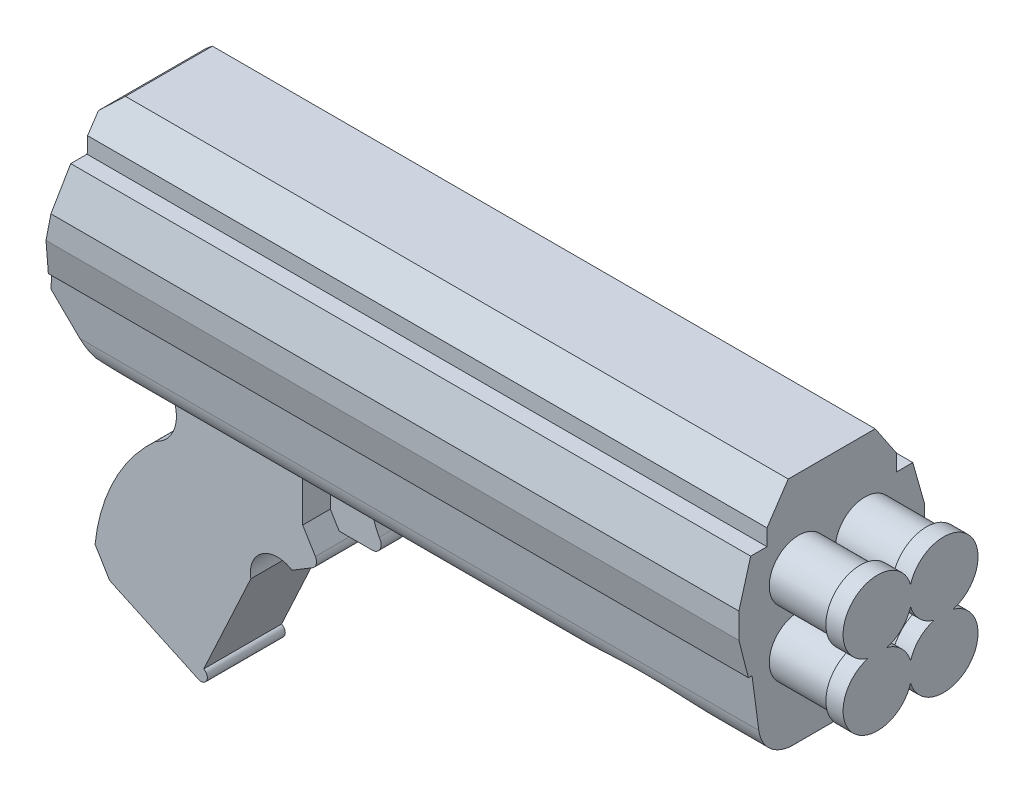
from build123d import *

# Parameters (mm, degrees)
BOSS_EXTRUDE1_DEPTH  = 26.035
CUT_EXTRUDE2_DEPTH   = 240.203331117
SKETCH5_R            = 8.255
BOSS_EXTRUDE8_DEPTH  = 17.272
BOSS_EXTRUDE11_DEPTH = 4.826
BOSS_EXTRUDE12_DEPTH = 3.175


with BuildPart() as part:
    # Sketch2 → Boss-Extrude1 (new, symmetric)
    with BuildSketch(Plane.XY):
        with BuildLine():
            Line((-190.5, -12.7), (-190.5, -4.318))
            Line((-190.5, -4.318), (-185.844103094, 0))
            Line((-185.844103094, 0), (0, 0))
            Line((0, 0), (0, -65.278))
            ThreePointArc((0, -65.278), (-1.691223097, -66.257526151), (-3.621280156, -65.949976488))
            ThreePointArc((-3.621280156, -65.949976488), (-30.794068936, -60.198), (-58.231280156, -64.516))
            ThreePointArc((-58.231280156, -64.516), (-72.616587259, -67.818), (-87.376, -67.818))
            Line((-87.376, -67.818), (-87.376, -62.23))
            Line((-87.376, -62.23), (-137.414, -62.23))
            Line((-137.414, -62.23), (-137.414, -80.518))
            Line((-137.414, -80.518), (-133.864978313, -86.386271386))
            ThreePointArc((-133.864978313, -86.386271386), (-133.604, -88.098814076), (-134.630411014, -89.494304159))
            Line((-134.630411014, -89.494304159), (-140.410798685, -92.990175405))
            ThreePointArc((-140.410798685, -92.990175405), (-148.759214045, -93.137080111), (-151.961017528, -100.848505043))
            Line((-151.961017528, -100.848505043), (-165.180503986, -129.361861638))
            ThreePointArc((-165.180503986, -129.361861638), (-164.315292958, -131.722788972), (-166.676220292, -132.588))
            Line((-166.676220292, -132.588), (-191.563573373, -121.049617069))
            Line((-191.563573373, -121.049617069), (-195.63837605, -114.311972144))
            ThreePointArc((-195.63837605, -114.311972144), (-190.211488894, -95.9874923), (-178.62037605, -80.792632353))
            ThreePointArc((-178.62037605, -80.792632353), (-172.890103094, -70.725763587), (-180.764103094, -62.23))
            Line((-180.764103094, -62.23), (-187.368103094, -60.953719707))
            Line((-187.368103094, -60.953719707), (-197.274103094, -47.752))
            Line((-197.274103094, -47.752), (-190.5, -12.7))
        make_face()
    extrude(amount=BOSS_EXTRUDE1_DEPTH, both=True)

    # Sketch4 → Cut-Extrude2 (cut, through all)
    with BuildSketch(Plane(origin=(0, 0, 0), x_dir=(0, 0, -1), z_dir=(1, 0, 0))):
        Polygon((-18.161, -8.89), (-12.192, 0), (-26.035, 0), (-26.035, -25.146), (-22.733, -13.462), (-18.161, -13.462), align=None)
        Polygon((26.035, 0), (12.192, 0), (18.161, -8.89), (18.161, -13.462), (22.733, -13.462), (26.035, -25.146), align=None)
        with BuildLine():
            Line((-26.035, -32.258), (-26.035, -132.752930819))
            Line((-26.035, -132.752930819), (-10.922, -132.752930819))
            Line((-10.922, -132.752930819), (-10.922, -65.278))
            ThreePointArc((-10.922, -65.278), (-17.251387415, -62.899090893), (-20.447, -56.940197221))
            Line((-20.447, -56.940197221), (-22.352, -42.672))
            Line((-22.352, -42.672), (-23.368, -42.672))
            Line((-23.368, -42.672), (-26.035, -32.258))
        make_face()
        with BuildLine():
            Line((26.035, -132.752930819), (26.035, -32.258))
            Line((26.035, -32.258), (23.368, -42.672))
            Line((23.368, -42.672), (22.352, -42.672))
            Line((22.352, -42.672), (20.447, -56.940197221))
            ThreePointArc((20.447, -56.940197221), (17.251387415, -62.899090893), (10.922, -65.278))
            Line((10.922, -65.278), (10.922, -132.752930819))
            Line((10.922, -132.752930819), (26.035, -132.752930819))
        make_face()
    extrude(amount=-CUT_EXTRUDE2_DEPTH, mode=Mode.SUBTRACT)

    # Sketch5 → Boss-Extrude8 (add)
    with BuildSketch(Plane(origin=(0, 0, 0), x_dir=(0, 0, -1), z_dir=(1, 0, 0))):
        with Locations((-9.271, -23.368)):
            Circle(SKETCH5_R)
        with Locations((9.271, -23.368)):
            Circle(SKETCH5_R)
        with Locations((9.271, -41.91)):
            Circle(SKETCH5_R)
        with Locations((-9.271, -41.91)):
            Circle(SKETCH5_R)
    extrude(amount=BOSS_EXTRUDE8_DEPTH)

    # Sketch6 → Boss-Extrude11 (add)
    with BuildSketch(Plane(origin=(17.272, 0, 0), x_dir=(0, 0, -1), z_dir=(1, 0, 0))):
        with BuildLine():
            ThreePointArc((0, -20.682918437), (-16.095994652, -16.543005348), (-11.956081563, -32.639))
            ThreePointArc((-11.956081563, -32.639), (-16.095994652, -48.734994652), (0, -44.595081563))
            ThreePointArc((0, -44.595081563), (16.095994652, -48.734994652), (11.956081563, -32.639))
            ThreePointArc((11.956081563, -32.639), (16.095994652, -16.543005348), (0, -20.682918437))
        make_face()
        with BuildLine():
            ThreePointArc((-6.585918437, -32.639), (-2.446005348, -35.085005348), (0, -39.224918437))
            ThreePointArc((0, -39.224918437), (2.446005348, -35.085005348), (6.585918437, -32.639))
            ThreePointArc((6.585918437, -32.639), (2.446005348, -30.192994652), (0, -26.053081563))
            ThreePointArc((0, -26.053081563), (-2.446005348, -30.192994652), (-6.585918437, -32.639))
        make_face(mode=Mode.SUBTRACT)
    extrude(amount=BOSS_EXTRUDE11_DEPTH)

    # Sketch8 → Boss-Extrude12 (add, symmetric)
    with BuildSketch(Plane.XY):
        with BuildLine():
            Line((-134.928247487, -84.628166584), (-125.716608685, -84.628166584))
            ThreePointArc((-125.716608685, -84.628166584), (-123.444, -83.222560591), (-123.686660911, -80.561434114))
            ThreePointArc((-123.686660911, -80.561434114), (-125.984, -71.326746209), (-123.19, -62.23))
            Line((-123.19, -62.23), (-137.414, -62.23))
            Line((-137.414, -62.23), (-137.414, -80.518))
            Line((-137.414, -80.518), (-134.928247487, -84.628166584))
        make_face()
    extrude(amount=BOSS_EXTRUDE12_DEPTH, both=True)


solid = part.part
